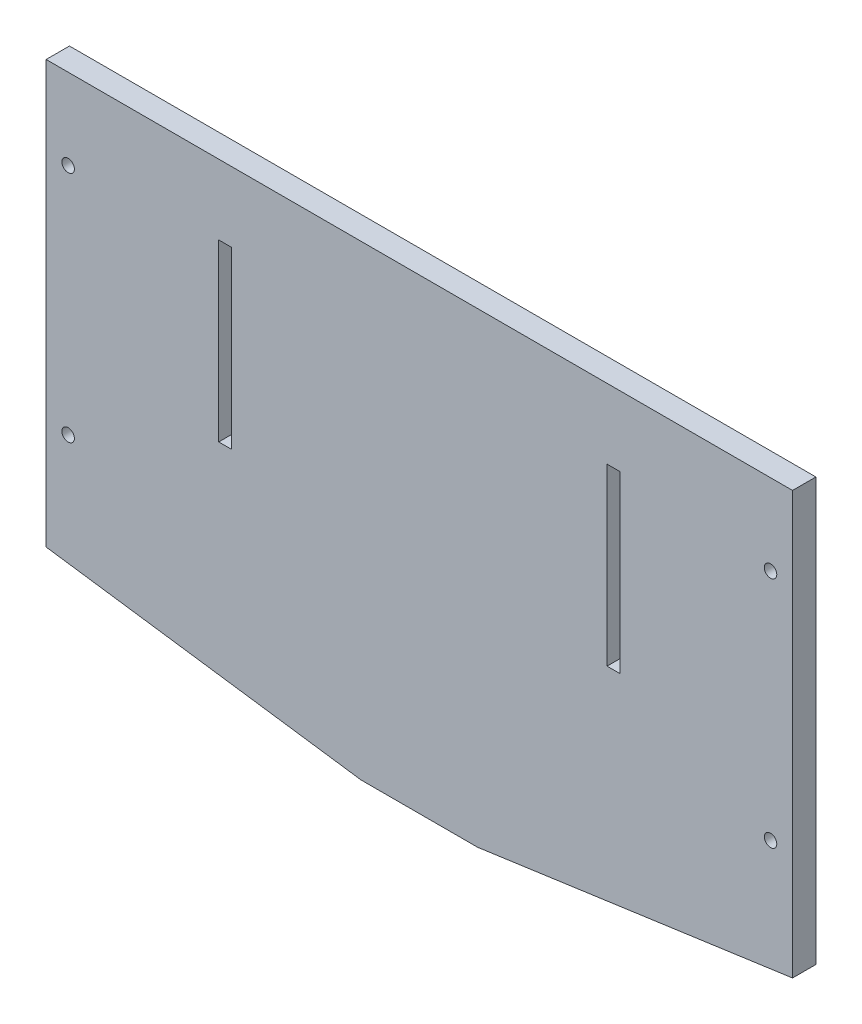
from build123d import *

# Parameters (mm, degrees)
SKETCH1_W            = 203.2
SKETCH1_H            = 127
BOSS_EXTRUDE1_DEPTH  = 6.35
M3_CLEARANCE_HOLE1_D = 3.4
SKETCH4_W            = 3.5052
SKETCH4_H            = 47.625
CUT_EXTRUDE1_DEPTH   = 240.70724332
CUT_EXTRUDE2_DEPTH   = 240.70724332


with BuildPart() as part:
    # Sketch1 → Boss-Extrude1 (new body)
    with BuildSketch(Plane.XY):
        with Locations((101.6, 63.5)):
            Rectangle(SKETCH1_W, SKETCH1_H)
    extrude(amount=BOSS_EXTRUDE1_DEPTH)

    # M3 Clearance Hole1 (through all)
    with Locations(Plane.XY.offset(6.35)):
        with Locations((5.9944, 105.0036), (5.9944, 41.5036), (197.2056, 41.5036), (197.2056, 105.0036)):
            Hole(M3_CLEARANCE_HOLE1_D / 2)

    # Sketch4 → Cut-Extrude1 (cut, through all)
    with BuildSketch(Plane.XY.offset(6.35)):
        with Locations((48.7426, 84.1375)):
            Rectangle(SKETCH4_W, SKETCH4_H)
        with Locations((154.4574, 84.1375)):
            Rectangle(SKETCH4_W, SKETCH4_H)
    extrude(amount=-CUT_EXTRUDE1_DEPTH, mode=Mode.SUBTRACT)

    # Sketch5 → Cut-Extrude2 (cut, through all)
    with BuildSketch(Plane.XY.offset(6.35)):
        Polygon((0, 12.047863055), (85.725, 0), (0, 0), align=None)
        Polygon((117.475, 0), (203.2, 0), (203.2, 12.047863055), align=None)
    extrude(amount=-CUT_EXTRUDE2_DEPTH, mode=Mode.SUBTRACT)


solid = part.part
